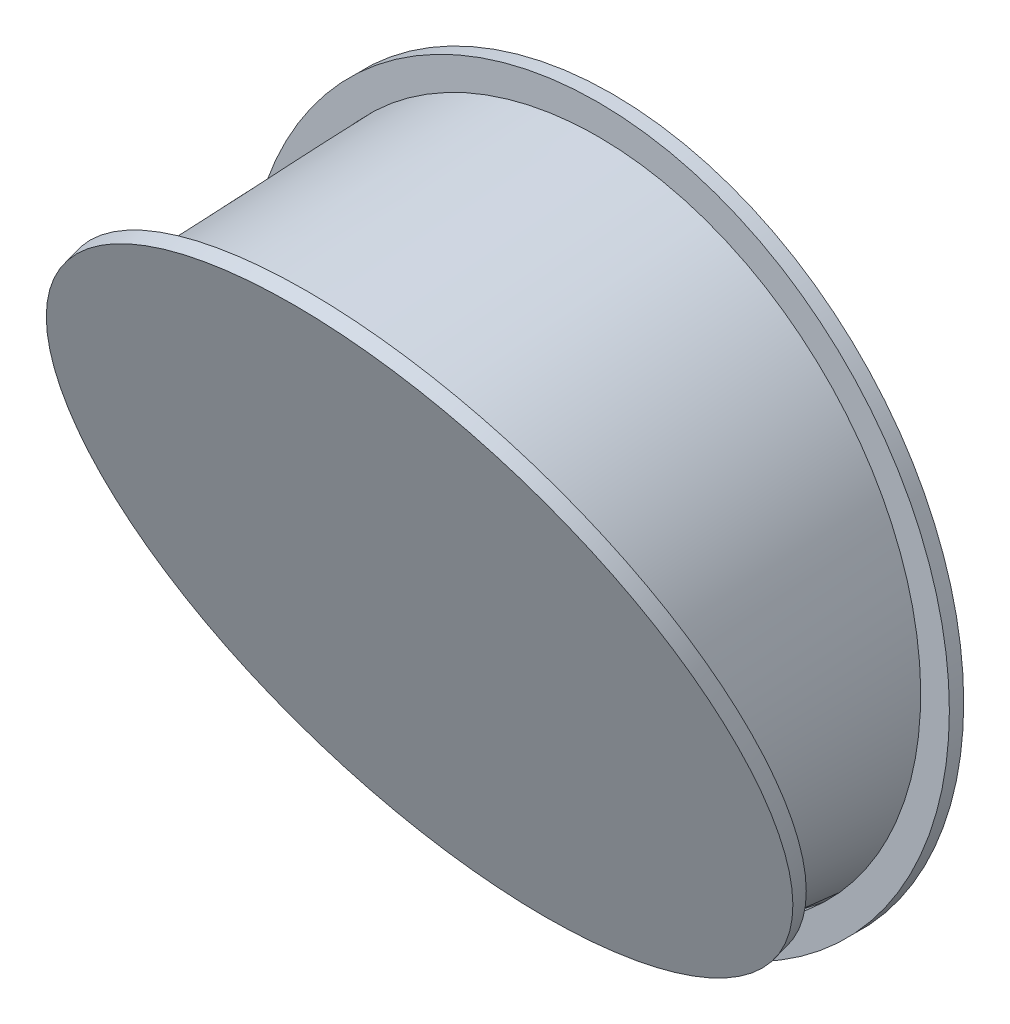
from build123d import *

# Parameters (mm, degrees)
SKETCH1_R           = 11.25
SKETCH3_R           = 11.25
SKETCH3_5_R         = 12.25
BOSS_EXTRUDE1_DEPTH = 0.5
SKETCH1_4_R         = 12.25
BOSS_EXTRUDE2_DEPTH = 0.5


with BuildPart() as part:
    # Sketch1 → Loft1 section 0
    with BuildSketch(Plane.XY):
        Circle(SKETCH1_R)
    # Sketch3 → Loft1 section 1
    with BuildSketch(Plane(origin=(0, -2.247482777, 5.854892806), x_dir=(1, 0, 0), z_dir=(0, -0.358367949545301, 0.9335804264972015))):
        with Locations((0, 2.407379925)):
            Circle(SKETCH3_R)
    loft()

    # Sketch3<5> → Boss-Extrude1 (add)
    with BuildSketch(Plane(origin=(0, -2.247482777, 5.854892806), x_dir=(1, 0, 0), z_dir=(0, -0.358367949545301, 0.9335804264972015))):
        with Locations(Location((0, 2.407379925, 0), (0, 0, 270))):
            Circle(SKETCH3_5_R)
    extrude(amount=-BOSS_EXTRUDE1_DEPTH)

    # Sketch1<4> → Boss-Extrude2 (add)
    with BuildSketch(Plane.XY):
        Circle(SKETCH1_4_R)
    extrude(amount=BOSS_EXTRUDE2_DEPTH)


solid = part.part
